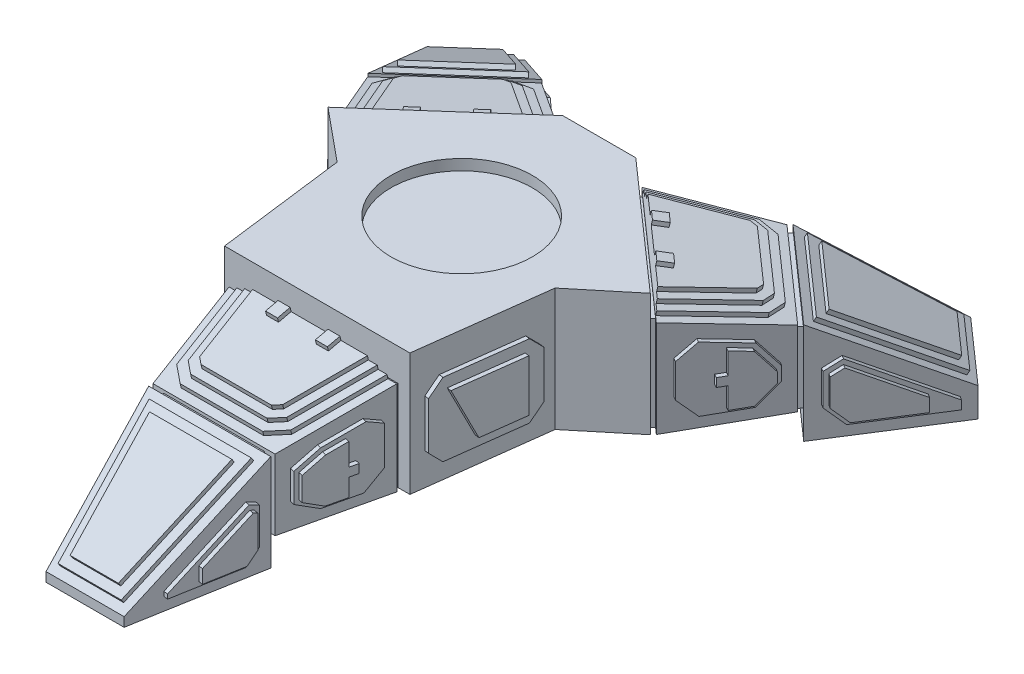
from build123d import *

# Parameters (mm, degrees)
BOSS_EXTRUDE1_DEPTH  = 13
SKETCH2_W            = 9.869565192
SKETCH2_H            = 11
BOSS_EXTRUDE2_DEPTH  = 12
DRAFT1_ANGLE         = 13
SKETCH3_W            = 5.854567171
SKETCH3_H            = 7.882584594
BOSS_EXTRUDE3_DEPTH  = 0.5
SKETCH4_W            = 7.099146898
SKETCH4_H            = 11.229581706
BOSS_EXTRUDE4_DEPTH  = 14.5
DRAFT2_ANGLE         = -35
DRAFT3_ANGLE         = -10
SKETCH5_W            = 0.5
SKETCH5_H            = 0.5
CUT_EXTRUDE1_DEPTH   = 64.828478767
SKETCH6_W            = 0.5
SKETCH6_H            = 0.5
CUT_EXTRUDE2_DEPTH   = 64.143287067
SKETCH7_W            = 17.337726852
SKETCH7_H            = 11
BOSS_EXTRUDE5_DEPTH  = 0.5
SKETCH8_W            = 19.337726852
SKETCH8_H            = 11.25
BOSS_EXTRUDE6_DEPTH  = 11.8
DRAFT4_ANGLE         = -12
SKETCH9_W            = 13.321391997
SKETCH9_H            = 8.241832572
BOSS_EXTRUDE7_DEPTH  = 0.5
SKETCH10_W           = 14.321391997
SKETCH10_H           = 11.741832572
BOSS_EXTRUDE8_DEPTH  = 14.5
DRAFT5_ANGLE         = -30
DRAFT6_ANGLE         = -9
SIDEDETAILS_DEPTH    = 0.5
BOSS_EXTRUDE10_DEPTH = 0.5
BOSS_EXTRUDE11_DEPTH = 0.5
BOSS_EXTRUDE12_DEPTH = 0.5
BOSS_EXTRUDE13_DEPTH = 0.5
BOSS_EXTRUDE14_DEPTH = 0.5
BOSS_EXTRUDE19_DEPTH = 0.5
BOSS_EXTRUDE20_DEPTH = 0.5
BOSS_EXTRUDE21_DEPTH = 0.5
BOSS_EXTRUDE22_DEPTH = 0.5
TOPDETAILS_DEPTH     = 0.5
BOSS_EXTRUDE24_DEPTH = 0.5
BOSS_EXTRUDE25_DEPTH = 0.5
BOSS_EXTRUDE26_DEPTH = 0.5
BOSS_EXTRUDE27_DEPTH = 0.5
BOSS_EXTRUDE28_DEPTH = 0.5
BOSS_EXTRUDE29_DEPTH = 0.5
BOSS_EXTRUDE30_DEPTH = 0.5
BOSS_EXTRUDE31_DEPTH = 0.5
SKETCH40_W           = 1.4
SKETCH40_H           = 1.5
BOSS_EXTRUDE32_DEPTH = 0.5
BOSS_EXTRUDE33_DEPTH = 0.5
BOSS_EXTRUDE34_DEPTH = 0.5
BOSS_EXTRUDE35_DEPTH = 1.25
SKETCH46_R           = 8.219205666
CUT_EXTRUDE4_DEPTH   = 1.25
BOSS_EXTRUDE36_DEPTH = 0.5
BOSS_EXTRUDE37_DEPTH = 0.5


# Read off the part's stored shape, not the designer's step: Mirror1
with BuildPart() as part:
    # Sketch1 → Boss-Extrude1 (new body)
    with BuildSketch(Plane(origin=(0, 0, 0), x_dir=(1, 0, 0), z_dir=(0, 1, 0))):
        Polygon((0, 26.080098009), (10.776618207, 26.080098009), (12.678283248, 41.069693042), (18.740564562, 46.074973313), (4.25, 58.880098009), (0, 58.880098009), align=None)
    extrude(amount=BOSS_EXTRUDE1_DEPTH)

    # Sketch2 → Boss-Extrude2 (add)
    with BuildSketch(Plane.XY.offset(-26.080098009)):
        with Locations((4.934782596, 5.5)):
            Rectangle(SKETCH2_W, SKETCH2_H)
    extrude(amount=BOSS_EXTRUDE2_DEPTH)

    # Draft1
    draft1_faces = [part.faces().sort_by_distance(p)[0] for p in [
        (9.869565192, 5.5, -20.080098009),
        (4.934782596, 11, -20.080098009),
    ]]
    draft(draft1_faces, Plane(origin=(0, 13, -26.080098009), x_dir=(1, 0, 0), z_dir=(0, 0, 1)), DRAFT1_ANGLE)

    # Sketch3 → Boss-Extrude3 (add)
    with BuildSketch(Plane.XY.offset(-14.080098009)):
        with Locations((2.927283586, 3.941292297)):
            Rectangle(SKETCH3_W, SKETCH3_H)
    extrude(amount=BOSS_EXTRUDE3_DEPTH)

    # Sketch4 → Boss-Extrude4 (add)
    with BuildSketch(Plane.XY.offset(-13.580098009)):
        with Locations((3.549573449, 2.614790853)):
            Rectangle(SKETCH4_W, SKETCH4_H)
    extrude(amount=BOSS_EXTRUDE4_DEPTH)

    # Draft2
    draft2_faces = [part.faces().sort_by_distance(p)[0] for p in [
        (3.549573449, 8.229581706, -6.330098009),
    ]]
    draft(draft2_faces, Plane(origin=(0, 0, -13.580098009), x_dir=(-1, 0, 0), z_dir=(0, 0, -1)), DRAFT2_ANGLE)

    # Draft3
    draft3_faces = [part.faces().sort_by_distance(p)[0] for p in [
        (7.099146898, 0.774587629, -8.323932877),
    ]]
    draft(draft3_faces, Plane(origin=(0, 0, -13.580098009), x_dir=(-1, 0, 0), z_dir=(0, 0, -1)), DRAFT3_ANGLE)

    # Sketch5 → Cut-Extrude1 (cut, through all)
    with BuildSketch(Plane(origin=(0, 13, 0), x_dir=(1, 0, 0), z_dir=(0, 1, 0))):
        with Locations((9.624845249, 25.830098009)):
            Rectangle(SKETCH5_W, SKETCH5_H)
    extrude(amount=-CUT_EXTRUDE1_DEPTH, mode=Mode.SUBTRACT)

    # Sketch6 → Cut-Extrude2 (cut, through all)
    with BuildSketch(Plane.ZY):
        with Locations((-25.830098009, 10.75)):
            Rectangle(SKETCH6_W, SKETCH6_H)
    extrude(amount=-CUT_EXTRUDE2_DEPTH, mode=Mode.SUBTRACT)

    # Sketch7 → Boss-Extrude5 (add)
    with BuildSketch(Plane(origin=(31.079976573, 0, -35.170794335), x_dir=(-0.7493416714874174, 0, -0.6621835541392156), z_dir=(0.6621835541392156, 0, -0.7493416714874174))):
        with Locations((26.135867038, 5.5)):
            Rectangle(SKETCH7_W, SKETCH7_H)
    extrude(amount=BOSS_EXTRUDE5_DEPTH)

    # Sketch8 → Boss-Extrude6 (add)
    with BuildSketch(Plane(origin=(31.41106835, 0, -35.545465171), x_dir=(-0.7493416714874174, 0, -0.6621835541392156), z_dir=(0.6621835541392156, 0, -0.7493416714874174))):
        with Locations((26.135867038, 5.625)):
            Rectangle(SKETCH8_W, SKETCH8_H)
    extrude(amount=BOSS_EXTRUDE6_DEPTH)

    # Draft4
    draft4_faces = [part.faces().sort_by_distance(p)[0] for p in [
        (8.487974746, 5.625, -63.675884707),
        (15.733257028, 11.25, -57.273322359),
        (22.978539309, 5.625, -50.87076001),
    ]]
    draft(draft4_faces, Plane(origin=(31.41106835, 0, -35.545465171), x_dir=(0.7493416714874174, 0, 0.6621835541392156), z_dir=(-0.6621835541392156, 0, 0.7493416714874174)), DRAFT4_ANGLE)

    # Sketch9 → Boss-Extrude7 (add)
    with BuildSketch(Plane(origin=(39.224834289, 0, -44.387696895), x_dir=(-0.7493416714874174, 0, -0.6621835541392157), z_dir=(0.6621835541392157, 0, -0.7493416714874174))):
        with Locations((26.135867038, 4.120916286)):
            Rectangle(SKETCH9_W, SKETCH9_H)
    extrude(amount=BOSS_EXTRUDE7_DEPTH)

    # Sketch10 → Boss-Extrude8 (add)
    with BuildSketch(Plane(origin=(39.555926066, 0, -44.76236773), x_dir=(-0.7493416714874173, 0, -0.6621835541392158), z_dir=(0.6621835541392158, 0, -0.7493416714874173))):
        with Locations((26.135867038, 2.870916286)):
            Rectangle(SKETCH10_W, SKETCH10_H)
    extrude(amount=BOSS_EXTRUDE8_DEPTH)

    # Draft5
    draft5_faces = [part.faces().sort_by_distance(p)[0] for p in [
        (24.772062542, 8.741832572, -67.501836174),
    ]]
    draft(draft5_faces, Plane(origin=(39.555926066, 0, -44.76236773), x_dir=(0.7493416714874173, 0, 0.6621835541392158), z_dir=(-0.6621835541392158, 0, 0.7493416714874173)), DRAFT5_ANGLE)

    # Draft6
    draft6_faces = [part.faces().sort_by_distance(p)[0] for p in [
        (18.519755952, 1.164485592, -71.240349631),
        (29.251371769, 1.164485592, -61.756959378),
    ]]
    draft(draft6_faces, Plane(origin=(39.555926066, 0, -44.76236773), x_dir=(0.7493416714874173, 0, 0.6621835541392158), z_dir=(-0.6621835541392158, 0, 0.7493416714874173)), DRAFT6_ANGLE)

    # Sketch11 → SideDetails (add)
    with BuildSketch(Plane(origin=(7.349657071, 0, 0.932419181), x_dir=(0.12585688758415473, 0, -0.992048408016277), z_dir=(0.992048408016277, 0, 0.12585688758415473))):
        Polygon((30.283902103, 10.75), (28.783902103, 9.25), (28.783902103, 3.75), (30.283902103, 2.25), (39.283902103, 2.25), (40.783902103, 3.75), (40.783902103, 9.25), (39.283902103, 10.75), align=None)
    extrude(amount=SIDEDETAILS_DEPTH)

    # Sketch12 → Boss-Extrude10 (add)
    with BuildSketch(Plane(origin=(7.845681275, 0, 0.995347624), x_dir=(0.12585688758415464, 0, -0.992048408016277), z_dir=(0.992048408016277, 0, 0.12585688758415464))):
        Polygon((30.729031337, 9.5), (33.63877287, 3.5), (38.83877287, 3.5), (38.83877287, 9.5), align=None)
    extrude(amount=BOSS_EXTRUDE10_DEPTH)

    # Sketch13 → Boss-Extrude11 (add)
    with BuildSketch(Plane(origin=(3.653754577, 0, 0.84353571), x_dir=(0.22495105434386303, 0, -0.9743700647852358), z_dir=(0.9743700647852358, 0, 0.22495105434386303))):
        Polygon((25.618683829, 7.779794143), (23.832342992, 8.607816183), (19.42013567, 7.615285494), (16.816186589, 6.226579644), (16.816186589, 2.88870585), (19.42013567, 1.5), (23.618683829, 1.5), (25.618683829, 3.306208105), align=None)
    extrude(amount=BOSS_EXTRUDE11_DEPTH)

    # Sketch14 → Boss-Extrude12 (add)
    with BuildSketch(Plane(origin=(4.140939609, 0, 0.956011237), x_dir=(0.22495105434386298, 0, -0.9743700647852358), z_dir=(0.9743700647852358, 0, 0.22495105434386298))):
        Polygon((21.845795906, 7.648445693), (21.845795906, 5.057642747), (22.845795906, 5.057642747), (22.845795906, 4.057642747), (21.845795906, 4.057642747), (21.845795906, 2), (19.545130349, 2), (17.316186589, 3.18871266), (17.316186589, 5.926572834), (19.595795906, 7.142305821), align=None)
    extrude(amount=BOSS_EXTRUDE12_DEPTH)

    # Sketch15 → Boss-Extrude13 (add)
    with BuildSketch(Plane(origin=(4.562747892, 0, 0.80453556), x_dir=(0.17364817766693072, 0, -0.9848077530122081), z_dir=(0.9848077530122081, 0, 0.17364817766693072))):
        Polygon((12.085161939, 4.668859254), (13.106539728, 4.266880396), (13.106539728, 0), (11.75533779, -1.5), (3.882853855, -1.5), (3.882853855, -0.987204792), align=None)
    extrude(amount=BOSS_EXTRUDE13_DEPTH)

    # Sketch16 → Boss-Extrude14 (add)
    with BuildSketch(Plane(origin=(5.055151769, 0, 0.891359648), x_dir=(0.17364817766693083, 0, -0.984807753012208), z_dir=(0.984807753012208, 0, 0.17364817766693083))):
        Polygon((7.045068136, 0.586010568), (7.045068136, -1), (11.53278915, -1), (12.606539728, 0.191994936), (12.606539728, 3.926333156), (12.149809697, 4.106086249), align=None)
    extrude(amount=BOSS_EXTRUDE14_DEPTH)

    # Sketch26 → Boss-Extrude19 (add)
    with BuildSketch(Plane(origin=(-5.436941118, 0, -3.071892781), x_dir=(0.49191636080750245, 0, -0.8706424604680747), z_dir=(0.8706424604680747, 0, 0.49191636080750245))):
        Polygon((53.280817781, 8.998937808), (51.322692251, 7.406054998), (51.322692251, 3.5), (53.322692251, 1.5), (58.13631127, 1.5), (60.38631127, 3.75), (60.38631127, 5.271622643), (58.183420048, 7.979629482), align=None)
    boss_extrude19 = extrude(amount=BOSS_EXTRUDE19_DEPTH)

    # Sketch27 → Boss-Extrude20 (add)
    with BuildSketch(Plane(origin=(-5.001619888, 0, -2.8259346), x_dir=(0.49191636080750223, 0, -0.8706424604680749), z_dir=(0.8706424604680749, 0, 0.49191636080750223))):
        Polygon((57.907675697, 7.526267467), (55.661865087, 7.993197749), (55.661865087, 5.496598874), (54.661865087, 5.496598874), (54.661865087, 4.496598874), (55.661865087, 4.496598874), (55.661865087, 2), (57.929204489, 2), (59.88631127, 3.957106781), (59.88631127, 5.093937351), align=None)
    boss_extrude20 = extrude(amount=BOSS_EXTRUDE20_DEPTH)

    # Sketch28 → Boss-Extrude21 (add)
    with BuildSketch(Plane(origin=(-7.928163292, 0, -5.044305282), x_dir=(0.5368081122456657, 0, -0.8437043621004011), z_dir=(0.8437043621004011, 0, 0.5368081122456657))):
        Polygon((65.205891173, 5.169001405), (63.468517642, 4.159724987), (63.468517642, 0.5), (65.468517642, -1.5), (75.149261966, -1.5), (75.149261966, -0.501127528), align=None)
    boss_extrude21 = extrude(amount=BOSS_EXTRUDE21_DEPTH)

    # Sketch29 → Boss-Extrude22 (add)
    with BuildSketch(Plane(origin=(-7.506311111, 0, -4.775901226), x_dir=(0.5368081122456659, 0, -0.843704362100401), z_dir=(0.843704362100401, 0, 0.5368081122456659))):
        Polygon((72.349261966, -1), (72.349261966, 0.51996897), (65.208204924, 4.592100543), (63.968517642, 3.871940418), (63.968517642, 0.707106781), (65.675624423, -1), align=None)
    boss_extrude22 = extrude(amount=BOSS_EXTRUDE22_DEPTH)

    # Sketch30 → TopDetails (add)
    with BuildSketch(Plane(origin=(12.395561175, 32.422644158, -14.027093352), x_dir=(0.943546922574932, -0.2997023380247018, 0.1410592552153272), z_dir=(0.3310917770696084, 0.8660254037844383, -0.37467083574370935))):
        Polygon((3.253811579, 57.981756134), (12.881846423, 50.771915563), (20.100266344, 63.785162226), (13.709627116, 68.570717194), align=None)
    extrude(amount=TOPDETAILS_DEPTH)

    # Sketch31 → Boss-Extrude24 (add)
    with BuildSketch(Plane(origin=(12.561107064, 32.85565686, -14.21442877), x_dir=(0.943546922574932, -0.2997023380247016, 0.14105925521532697), z_dir=(0.3310917770696081, 0.8660254037844382, -0.3746708357437095))):
        Polygon((13.80837023, 67.247471292), (4.770950355, 58.094967902), (12.563516999, 52.259596089), (18.802713877, 63.507515834), align=None)
    extrude(amount=BOSS_EXTRUDE24_DEPTH)

    # Sketch33 → Boss-Extrude25 (add)
    with BuildSketch(Plane(origin=(2.872820297, 20.410589756, -3.25094749), x_dir=(0.9904756153237979, -0.1356663889180455, 0.023509282568419283), z_dir=(0.13767570237279786, 0.9781476007338056, -0.1557968939191553))):
        Polygon((3.202221741, 56.706351349), (2.39215277, 56.084245625), (15.49778881, 44.798952625), (15.992758419, 45.692391128), (20.247034518, 53.371517277), (19.837285819, 55.662394768), (12.491105421, 61.988207415), (10.1647847, 62.053365524), align=None)
    extrude(amount=BOSS_EXTRUDE25_DEPTH)

    # Sketch34 → Boss-Extrude26 (add)
    with BuildSketch(Plane(origin=(2.941658148, 20.899663556, -3.328845936), x_dir=(0.9904756153237978, -0.13566638891804614, 0.023509282568419398), z_dir=(0.13767570237279853, 0.9781476007338055, -0.15579689391915558))):
        Polygon((3.976198794, 56.039877949), (3.166129822, 55.417772225), (14.723811758, 45.465426026), (15.218781367, 46.358864528), (19.200087319, 53.545269438), (18.91547661, 55.136508816), (12.107876049, 60.998549141), (10.492017867, 61.043807846), align=None)
    extrude(amount=BOSS_EXTRUDE26_DEPTH)

    # Sketch35 → Boss-Extrude27 (add)
    with BuildSketch(Plane(origin=(0, 4.726986018, 1.091310712), x_dir=(1, 0, 0), z_dir=(0, 0.9743700647852351, 0.22495105434386561))):
        Polygon((1, 16.570479091), (0, 16.570479091), (0, 27.372976331), (8.729141839, 27.372976331), (8.504190785, 26.372976331), (6.628308811, 18.033909063), (4.799108696, 16.570479091), align=None)
    extrude(amount=BOSS_EXTRUDE27_DEPTH)

    # Sketch36 → Boss-Extrude28 (add)
    with BuildSketch(Plane(origin=(3.010495999, 21.388737356, -3.406744383), x_dir=(0.9904756153237978, -0.1356663889180453, 0.02350928256841947), z_dir=(0.13767570237279772, 0.9781476007338057, -0.15579689391915463))):
        Polygon((4.750175847, 55.373404549), (3.940106875, 54.751298824), (13.949834705, 46.131899426), (14.444804314, 47.025337928), (18.153140119, 53.719021598), (17.993667402, 54.610622863), (11.724646677, 60.008890867), (10.819251035, 60.034250168), align=None)
    extrude(amount=BOSS_EXTRUDE28_DEPTH)

    # Sketch37 → Boss-Extrude29 (add)
    with BuildSketch(Plane(origin=(3.07933385, 21.877811157, -3.48464283), x_dir=(0.990475615323798, -0.13566638891804428, 0.02350928256841908), z_dir=(0.1376757023727966, 0.978147600733806, -0.15579689391915338))):
        Polygon((7.195770117, 53.92732674), (6.216991182, 52.79066857), (7.277872141, 51.877141564), (8.256651076, 53.013799734), align=None)
        Polygon((12.651729334, 49.229187851), (11.672950399, 48.09252968), (10.61206944, 49.006056687), (11.590848375, 50.142714857), align=None)
    extrude(amount=BOSS_EXTRUDE29_DEPTH)

    # Sketch38 → Boss-Extrude30 (add)
    with BuildSketch(Plane(origin=(0, 5.214171051, 1.203786239), x_dir=(1, 0, 0), z_dir=(0, 0.9743700647852351, 0.2249510543438655))):
        Polygon((1, 17.570479091), (0, 17.570479091), (0, 27.372976331), (7.704152582, 27.372976331), (7.479201528, 26.372976331), (5.729676477, 18.595617579), (4.448314556, 17.570479091), align=None)
    extrude(amount=BOSS_EXTRUDE30_DEPTH)

    # Sketch39 → Boss-Extrude31 (add)
    with BuildSketch(Plane(origin=(0, 5.701356083, 1.316261766), x_dir=(1, 0, 0), z_dir=(0, 0.9743700647852352, 0.22495105434386536))):
        Polygon((1, 18.570479091), (0, 18.570479091), (0, 27.372976331), (6.679163325, 27.372976331), (6.454212271, 26.372976331), (4.831044143, 19.157326094), (4.097520417, 18.570479091), align=None)
    extrude(amount=BOSS_EXTRUDE31_DEPTH)

    # Sketch40 → Boss-Extrude32 (add)
    with BuildSketch(Plane(origin=(0, 6.188541116, 1.428737293), x_dir=(1, 0, 0), z_dir=(0, 0.9743700647852352, 0.22495105434386545))):
        with Locations((2.9, 26.622976331)):
            Rectangle(SKETCH40_W, SKETCH40_H)
    extrude(amount=BOSS_EXTRUDE32_DEPTH)

    # Sketch41 → Boss-Extrude33 (add)
    with BuildSketch(Plane(origin=(0, -0.858426734, -0.60107687), x_dir=(1, 0, 0), z_dir=(0, 0.8191520442889909, 0.5735764363510476))):
        Polygon((1, -0.856772343), (0, -0.856772343), (0, 14.844459194), (5.944330881, 14.844459194), (3.676466874, -0.856772343), align=None)
    extrude(amount=BOSS_EXTRUDE33_DEPTH)

    # Mirror2: Boss-Extrude19, Boss-Extrude20, Boss-Extrude21, Boss-Extrude22 across plane
    add(boss_extrude19.mirror(Plane(origin=(-19.584694292, 0, -17.306741326), x_dir=(-0.6621835541392167, 2.5373469794802872e-15, 0.7493416714874163), z_dir=(-0.7493416714874163, 2.8713184053912184e-15, -0.6621835541392168))))
    add(boss_extrude20.mirror(Plane(origin=(-19.584694292, 0, -17.306741326), x_dir=(-0.6621835541392167, 2.5373469794802872e-15, 0.7493416714874163), z_dir=(-0.7493416714874163, 2.8713184053912184e-15, -0.6621835541392168))))
    add(boss_extrude21.mirror(Plane(origin=(-19.584694292, 0, -17.306741326), x_dir=(-0.6621835541392167, 2.5373469794802872e-15, 0.7493416714874163), z_dir=(-0.7493416714874163, 2.8713184053912184e-15, -0.6621835541392168))))
    add(boss_extrude22.mirror(Plane(origin=(-19.584694292, 0, -17.306741326), x_dir=(-0.6621835541392167, 2.5373469794802872e-15, 0.7493416714874163), z_dir=(-0.7493416714874163, 2.8713184053912184e-15, -0.6621835541392168))))

    # Sketch42 → Boss-Extrude34 (add)
    with BuildSketch(Plane(origin=(0, -0.448850712, -0.314288652), x_dir=(1, 0, 0), z_dir=(0, 0.8191520442889909, 0.5735764363510476))):
        Polygon((1, 0.143227657), (0, 0.143227657), (0, 13.844459194), (4.789514864, 13.844459194), (2.810528071, 0.143227657), align=None)
    extrude(amount=BOSS_EXTRUDE34_DEPTH)

    # Mirror1: part across plane


with BuildPart() as part_1:
    add(part.part)
    add(part.part.mirror(Plane(origin=(0, 0, 0), x_dir=(0, 0, 1), z_dir=(1, 0, 0))))

    # Sketch45 → Boss-Extrude35 (add)
    with BuildSketch(Plane(origin=(0, 13, 0), x_dir=(1, 0, 0), z_dir=(0, 1, 0))):
        Polygon((10.776618207, 26.080098009), (12.678283248, 41.069693042), (18.740564562, 46.074973313), (4.25, 58.880098009), (-4.25, 58.880098009), (-18.740564562, 46.074973313), (-12.678283248, 41.069693042), (-10.776618207, 26.080098009), align=None)
    extrude(amount=BOSS_EXTRUDE35_DEPTH)

    # Sketch46 → Cut-Extrude4 (cut)
    with BuildSketch(Plane(origin=(0, 14.25, 0), x_dir=(1, 0, 0), z_dir=(0, 1, 0))):
        with Locations(Location((0, 42.880098009, 0), (0, 0, 270))):
            Circle(SKETCH46_R)
    extrude(amount=-CUT_EXTRUDE4_DEPTH, mode=Mode.SUBTRACT)

    # Sketch47 → Boss-Extrude36 (add)
    with BuildSketch(Plane(origin=(0, 0, -58.880098009), x_dir=(-1, 0, 0), z_dir=(0, 0, -1))):
        Polygon((3.25, 12.25), (2.25, 13.25), (-2.25, 13.25), (-3.25, 12.25), (-3.25, 2), (-2.25, 1), (2.25, 1), (3.25, 2), align=None)
    extrude(amount=BOSS_EXTRUDE36_DEPTH)

    # Sketch48 → Boss-Extrude37 (add)
    with BuildSketch(Plane(origin=(0, 0, -59.380098009), x_dir=(-1, 0, 0), z_dir=(0, 0, -1))):
        Polygon((2.75, 2.207106781), (2.75, 12.042893219), (2.042893219, 12.75), (-2.042893219, 12.75), (-2.75, 12.042893219), (-2.75, 2.207106781), (-2.042893219, 1.5), (2.042893219, 1.5), align=None)
    extrude(amount=BOSS_EXTRUDE37_DEPTH)


solid = part_1.part
